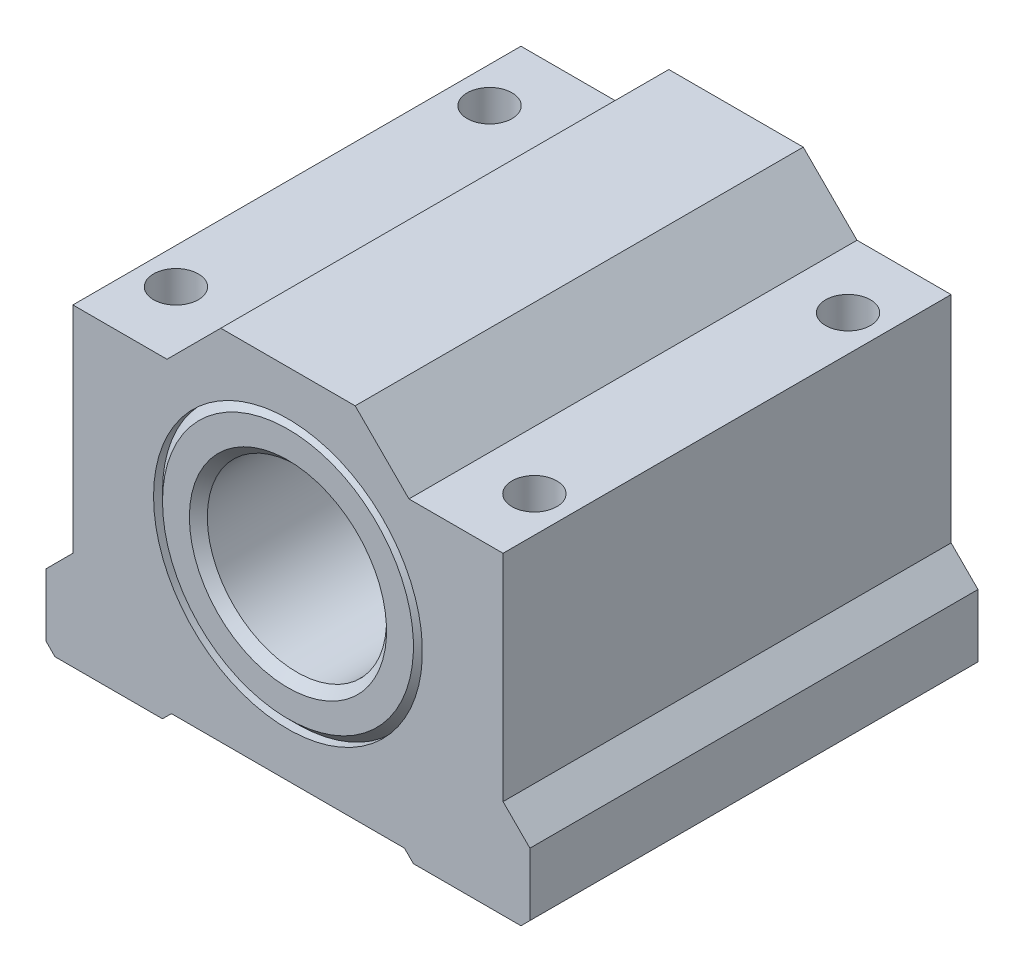
from build123d import *

# Parameters (mm, degrees)
IZIM1_W                     = 48
IZIM1_H                     = 34
Y_KSEKLIK_EKSTR_ZYON1_DEPTH = 50
IZIM2_W                     = 14
IZIM2_H                     = 11
Y_KSEKLIK_EKSTR_ZYON2_DEPTH = 50
IZIM3_R                     = 15
KES_EKSTR_ZYON1_DEPTH       = 50
IZIM4_R                     = 15
IZIM4_R_2                   = 10
Y_KSEKLIK_EKSTR_ZYON3_DEPTH = 50
IZIM5_R                     = 2.5
KES_EKSTR_ZYON2_DEPTH       = 50
PAH1_SIZE                   = 1
PAH2_SIZE                   = 3
PAH3_SIZE                   = 1


with BuildPart() as part:
    # Çizim1 → Yükseklik-Ekstrüzyon1 (new body)
    with BuildSketch(Plane.XY):
        Rectangle(IZIM1_W, IZIM1_H)
    extrude(amount=Y_KSEKLIK_EKSTR_ZYON1_DEPTH)

    # Çizim2 → Yükseklik-Ekstrüzyon2 (add)
    with BuildSketch(Plane.XY.offset(50)):
        with Locations((-20, -12.5)):
            Rectangle(IZIM2_W, IZIM2_H)
        with Locations((20, -12.5)):
            Rectangle(IZIM2_W, IZIM2_H)
        Polygon((-13.5, 17), (13.5, 17), (7.5, 23), (-7.5, 23), align=None)
    extrude(amount=-Y_KSEKLIK_EKSTR_ZYON2_DEPTH)

    # Çizim3 → Kes-Ekstrüzyon1 (cut)
    with BuildSketch(Plane(origin=(0, 0, 0), x_dir=(-1, 0, 0), z_dir=(0, 0, -1))):
        with Locations((0, 3)):
            Circle(IZIM3_R)
    extrude(amount=-KES_EKSTR_ZYON1_DEPTH, mode=Mode.SUBTRACT)

    # Çizim5 → Kes-Ekstrüzyon2 (cut)
    with BuildSketch(Plane.XZ.offset(18)):
        with Locations((-20, 42.5)):
            Circle(IZIM5_R)
        with Locations((-20, 7.5)):
            Circle(IZIM5_R)
        with Locations((20, 7.5)):
            Circle(IZIM5_R)
        with Locations((20, 42.5)):
            Circle(IZIM5_R)
    extrude(amount=-KES_EKSTR_ZYON2_DEPTH, mode=Mode.SUBTRACT)

    # Pah1
    pah1_edges = [part.edges().sort_by_distance(p)[0] for p in [
        (-27, -18, 25),
        (27, -18, 25),
        (13, -18, 25),
        (-13, -18, 25),
    ]]
    chamfer(pah1_edges, length=PAH1_SIZE - 0.0001)  # a hair under: the kernel refuses the full size

    # Pah2
    pah2_edges = [part.edges().sort_by_distance(p)[0] for p in [
        (-27, -7, 25),
        (27, -7, 25),
    ]]
    chamfer(pah2_edges, length=PAH2_SIZE - 0.0001)  # a hair under: the kernel refuses the full size


with BuildPart() as body_2:
    # Çizim4 → Yükseklik-Ekstrüzyon3 (new body)
    with BuildSketch(Plane(origin=(0, 0, 0), x_dir=(-1, 0, 0), z_dir=(0, 0, -1))):
        with Locations((0, 3)):
            Circle(IZIM4_R)
        with Locations((0, 3)):
            Circle(IZIM4_R_2, mode=Mode.SUBTRACT)
    extrude(amount=-Y_KSEKLIK_EKSTR_ZYON3_DEPTH)

    # Pah3
    pah3_edges = [body_2.edges().sort_by_distance(p)[0] for p in [
        (15, 3, 0),
        (15, 3, 50),
        (10, 3, 50),
        (10, 3, 0),
    ]]
    chamfer(pah3_edges, length=PAH3_SIZE)


solid = Compound([part.part, body_2.part])
